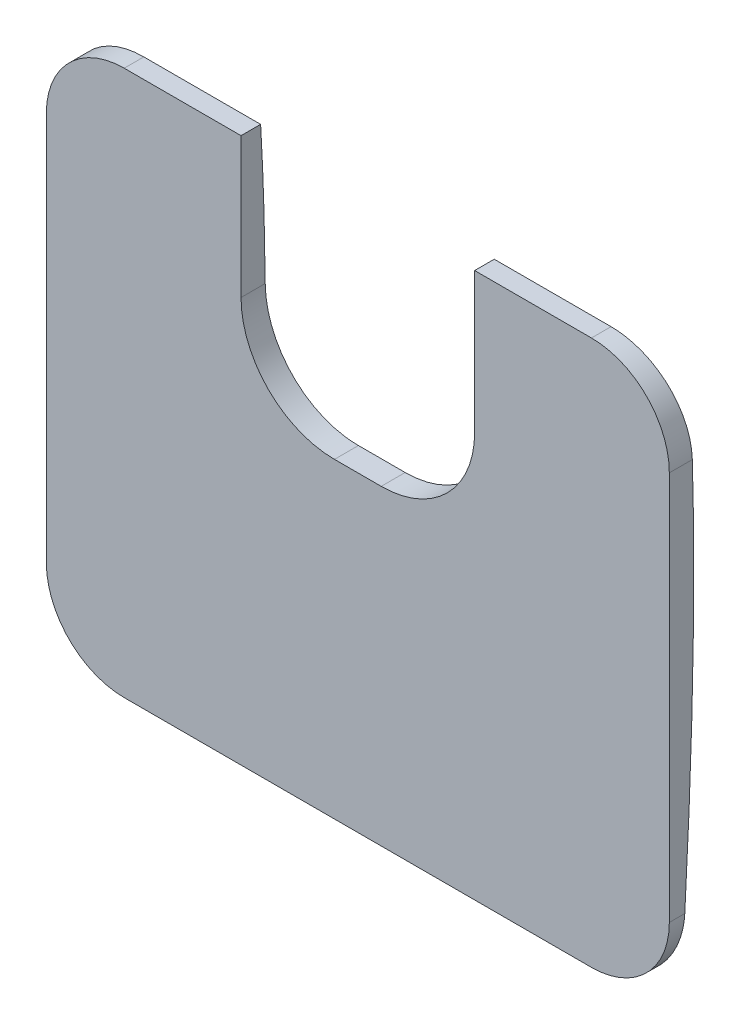
from build123d import *

# Parameters (mm, degrees)
BOSS_EXTRUDE1_DEPTH = 5
CUT_EXTRUDE1_DEPTH  = 5
CAVITY1_START       = 286.807940561
CAVITY1_DEPTH       = 40
CUT_EXTRUDE2_DEPTH  = 3


# Read off the part's stored shape, not the designer's step: Cavity1
with BuildPart() as part:
    # Sketch1 → Boss-Extrude1 (new body)
    with BuildSketch(Plane.XY):
        with BuildLine():
            Line((326.807940561, 10.696584157), (326.807940561, -14.303415843))
            ThreePointArc((326.807940561, -14.303415843), (325.343474467, -17.838949749), (321.807940561, -19.303415843))
            Line((321.807940561, -19.303415843), (291.807940561, -19.303415843))
            ThreePointArc((291.807940561, -19.303415843), (288.272406655, -17.838949749), (286.807940561, -14.303415843))
            Line((286.807940561, -14.303415843), (286.807940561, 10.696584157))
            ThreePointArc((286.807940561, 10.696584157), (287.241237169, 12.732565524), (288.466028612, 14.415673363))
            ThreePointArc((288.466028612, 14.415673363), (290.018449856, 15.365387324), (291.807940561, 15.696584157))
            Line((291.807940561, 15.696584157), (321.807940561, 15.696584157))
            ThreePointArc((321.807940561, 15.696584157), (323.597431267, 15.365387324), (325.14985251, 14.415673363))
            ThreePointArc((325.14985251, 14.415673363), (326.374643954, 12.732565524), (326.807940561, 10.696584157))
        make_face()
    extrude(amount=-BOSS_EXTRUDE1_DEPTH)

    # Sketch2 → Cut-Extrude1 (cut)
    with BuildSketch(Plane.XY):
        with BuildLine():
            Line((314.307940561, 15.696584157), (299.307940561, 15.696584157))
            Line((299.307940561, 15.696584157), (299.307940561, 6.696584157))
            ThreePointArc((299.307940561, 6.696584157), (301.065299874, 2.45394347), (305.307940561, 0.696584157))
            Line((305.307940561, 0.696584157), (308.307940561, 0.696584157))
            ThreePointArc((308.307940561, 0.696584157), (312.550581249, 2.45394347), (314.307940561, 6.696584157))
            Line((314.307940561, 6.696584157), (314.307940561, 15.696584157))
        make_face()
    extrude(amount=-CUT_EXTRUDE1_DEPTH, mode=Mode.SUBTRACT)

    # Cavity1 outline → Cavity1 (cut)
    with BuildSketch(Plane.YZ.offset(CAVITY1_START)):
        with BuildLine():
            add(Edge.make_bspline(
                [(-19.303419089, -3.689556548), (-16.202204445, -3.892989258), (-9.864860791, -4.253224972), (-0.295866357, -4.576033421), (7.774910047, -4.584255677), (13.098555958, -4.40143973), (15.199220063, -4.287786884), (15.696587408, -4.2583405)],
                knots=[0.587686308, 0.587686308, 0.587686308, 0.587686308, 0.628495956, 0.671074693, 0.71365343, 0.734942799, 0.741555068, 0.741555068, 0.741555068, 0.741555068], degree=3))
            Line((-19.303419089, -3.689556548), (-19.303415843, -5))
            Line((-19.303415843, -5), (15.696584157, -5))
            Line((15.696584157, -5), (15.696587408, -4.2583405))
        make_face()
    extrude(amount=CAVITY1_DEPTH, mode=Mode.SUBTRACT)

    # Sketch3 → Cut-Extrude2 (cut)
    with BuildSketch(Plane.XY):
        with BuildLine():
            Line((314.307940561, 15.696584157), (314.307940561, 6.696584157))
            ThreePointArc((314.307940561, 6.696584157), (312.550581249, 2.45394347), (308.307940561, 0.696584157))
            Line((308.307940561, 0.696584157), (305.307940561, 0.696584157))
            ThreePointArc((305.307940561, 0.696584157), (301.065299874, 2.45394347), (299.307940561, 6.696584157))
            Line((299.307940561, 6.696584157), (299.307940561, 15.696584157))
            Line((299.307940561, 15.696584157), (291.807940561, 15.696584157))
            ThreePointArc((291.807940561, 15.696584157), (288.272406655, 14.232118063), (286.807940561, 10.696584157))
            Line((286.807940561, 10.696584157), (286.807940561, -14.303415843))
            ThreePointArc((286.807940561, -14.303415843), (288.272406655, -17.838949749), (291.807940561, -19.303415843))
            Line((291.807940561, -19.303415843), (321.807940561, -19.303415843))
            ThreePointArc((321.807940561, -19.303415843), (325.343474467, -17.838949749), (326.807940561, -14.303415843))
            Line((326.807940561, -14.303415843), (326.807940561, 10.696584157))
            ThreePointArc((326.807940561, 10.696584157), (325.343474467, 14.232118063), (321.807940561, 15.696584157))
            Line((321.807940561, 15.696584157), (314.307940561, 15.696584157))
        make_face()
    extrude(amount=-CUT_EXTRUDE2_DEPTH, mode=Mode.SUBTRACT)


solid = part.part
